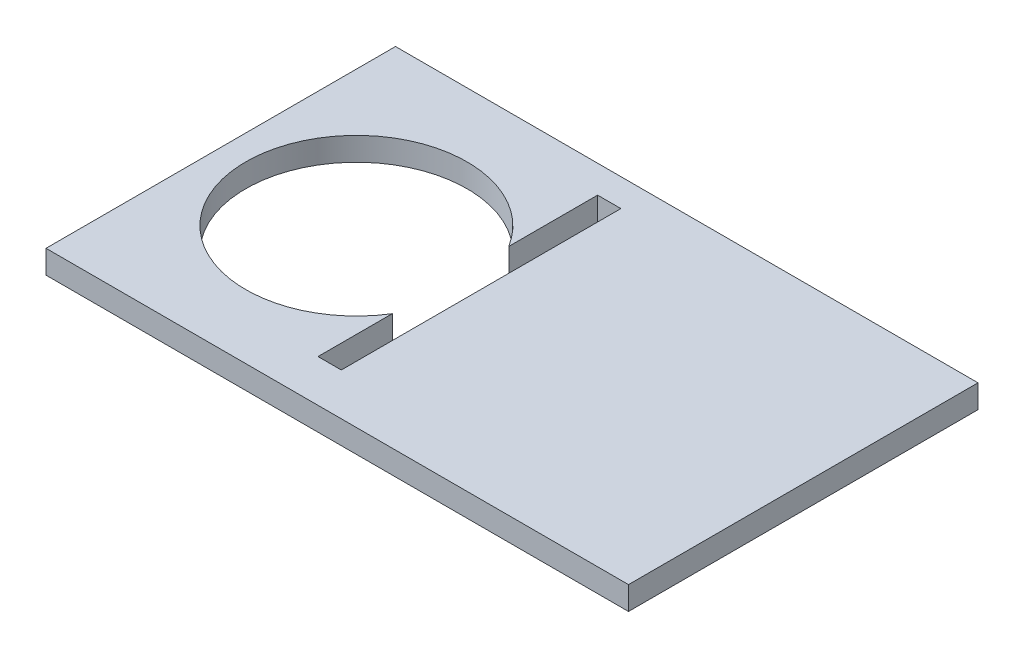
from build123d import *

# Parameters (mm, degrees)
SKETCH1_W           = 127
SKETCH1_H           = 76.2
SKETCH1_R           = 24.13
BOSS_EXTRUDE1_DEPTH = 5.08
CAVITY1_START       = -13.407959225
CAVITY1_OUTLINE_W   = 5.08
CAVITY1_OUTLINE_H   = 60.96
CAVITY1_DEPTH       = 5.08


# Read off the part's stored shape, not the designer's step: Cavity1
with BuildPart() as part:
    # Sketch1 → Boss-Extrude1 (new body)
    with BuildSketch(Plane(origin=(0, 0, 0), x_dir=(1, 0, 0), z_dir=(0, 1, 0))):
        Rectangle(SKETCH1_W, SKETCH1_H)
        with Locations(Location((-33.925370199, 0, 0), (0, 0, 270))):
            Circle(SKETCH1_R, mode=Mode.SUBTRACT)
    extrude(amount=BOSS_EXTRUDE1_DEPTH)

    # Cavity1 outline → Cavity1 (cut)
    with BuildSketch(Plane.YZ.offset(CAVITY1_START)):
        with Locations((2.54, -1.5875)):
            Rectangle(CAVITY1_OUTLINE_W, CAVITY1_OUTLINE_H)
    extrude(amount=CAVITY1_DEPTH, mode=Mode.SUBTRACT)


solid = part.part
